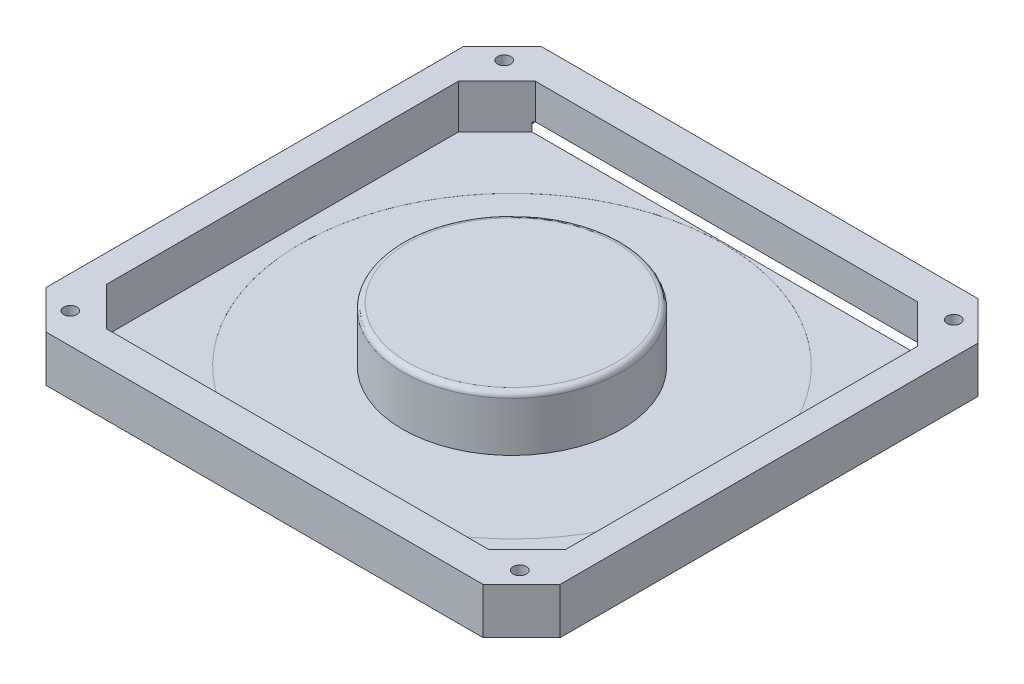
from build123d import *

# Parameters (mm, degrees)
BOSS_EXTRUDE1_DEPTH           = 8.4
CUT_EXTRUDE1_DEPTH            = 66.430287329
CUT_EXTRUDE1_DEPTH_BACK       = 2
CUT_EXTRUDE2_DEPTH            = 8
SKETCH8_R                     = 19.9
BOSS_EXTRUDE2_DEPTH           = 10
FILLET1_R                     = 1
SKETCH9_R                     = 38.5
CUT_EXTRUDE4_DEPTH            = 0.01
M2_CLEARANCE_HOLE1_AT_2_COUNT = 2
M2_CLEARANCE_HOLE1_AT_2_PITCH = 81.742360825
M2_CLEARANCE_HOLE1_AT_3_COUNT = 2
M2_CLEARANCE_HOLE1_AT_3_PITCH = 113.62
M2_CLEARANCE_HOLE1_AT_4_COUNT = 2
M2_CLEARANCE_HOLE1_AT_4_PITCH = 78.915719896


with BuildPart() as part:
    # Sketch4 → Boss-Extrude1 (new body)
    with BuildSketch(Plane(origin=(0, 0, 0), x_dir=(1, 0, 0), z_dir=(0, 1, 0))):
        Polygon((-46.75, 38), (-39.75, 45), (39.75, 45), (46.75, 38), (46.75, -38), (39.75, -45), (-39.75, -45), (-46.75, -38), align=None)
    extrude(amount=BOSS_EXTRUDE1_DEPTH)

    # Sketch5 → Cut-Extrude1 (cut, two sides: drawn at the far end of the back side and taken through both)
    with BuildSketch(Plane.XZ.offset(-CUT_EXTRUDE1_DEPTH_BACK)):
        with BuildLine():
            Line((36.75, -300.538184403), (36.75, -45))
            Line((36.75, -45), (36.75, -39.704788024))
            ThreePointArc((36.75, -39.704788024), (36.457106781, -38.997681243), (35.75, -38.704788024))
            Line((35.75, -38.704788024), (-35.75, -38.704788024))
            ThreePointArc((-35.75, -38.704788024), (-36.457106781, -38.997681243), (-36.75, -39.704788024))
            Line((-36.75, -39.704788024), (-36.75, -45))
            Line((-36.75, -45), (-36.75, -300.538184403))
            Line((-36.75, -300.538184403), (-36.75, -811.614553209))
            Line((-36.75, -811.614553209), (36.75, -811.614553209))
            Line((36.75, -811.614553209), (36.75, -300.538184403))
        make_face()
    extrude(amount=CUT_EXTRUDE1_DEPTH + CUT_EXTRUDE1_DEPTH_BACK, mode=Mode.SUBTRACT)

    # Sketch6 → Cut-Extrude2 (cut)
    with BuildSketch(Plane(origin=(0, 8.4, 0), x_dir=(1, 0, 0), z_dir=(0, 1, 0))):
        Polygon((-41.75, 32), (-34.75, 39), (34.75, 39), (41.75, 32), (41.75, -32), (34.75, -39), (-34.75, -39), (-41.75, -32), align=None)
    extrude(amount=-CUT_EXTRUDE2_DEPTH, mode=Mode.SUBTRACT)

    # Sketch8 → Boss-Extrude2 (add)
    with BuildSketch(Plane(origin=(0, 0.4, 0), x_dir=(1, 0, 0), z_dir=(0, 1, 0))):
        Circle(SKETCH8_R)
    extrude(amount=BOSS_EXTRUDE2_DEPTH)

    # Fillet1
    fillet1_edges = [part.edges().sort_by_distance(p)[0] for p in [
        (-19.9, 10.4, 0),
    ]]
    fillet(fillet1_edges, radius=FILLET1_R)

    # Sketch9 → Cut-Extrude4 (cut)
    with BuildSketch(Plane(origin=(0, 0.4, 0), x_dir=(1, 0, 0), z_dir=(0, 1, 0))):
        Circle(SKETCH9_R)
    extrude(amount=-CUT_EXTRUDE4_DEPTH, mode=Mode.SUBTRACT)


with BuildPart() as cut_extrude4_piece_1:
    # of the separate pieces the step leaves, piece 1, a body of its own (cut_extrude4_pieces)
    add(part.part.solids().sort_by_distance((-41.75, 0.4, 32))[0])

    # Sketch10 → M2 Clearance Hole1 (revolve, cut)
    with BuildSketch(Plane(origin=(40.871180413, 8.4, 39.457859948), x_dir=(0, 0, 1), z_dir=(1, 0, 0))):
        Polygon((0, 0), (0, 38.821032743), (1.2, 38.1), (1.2, 0), align=None)
    m2_clearance_hole1 = revolve(axis=Axis((40.871180413, 14.75, 39.457859948), (0, -1, 0)), mode=Mode.SUBTRACT)

    # M2 Clearance Hole1 at 2: M2 Clearance Hole1 ×2
    with Locations(*[(-i * M2_CLEARANCE_HOLE1_AT_2_PITCH, 0, 0) for i in range(1, M2_CLEARANCE_HOLE1_AT_2_COUNT)]):
        add(m2_clearance_hole1, mode=Mode.SUBTRACT)

    # M2 Clearance Hole1 at 3: M2 Clearance Hole1 ×2
    with Locations(*[Vector(-0.7194363741011156, 0, -0.6945583514869285) * (i * M2_CLEARANCE_HOLE1_AT_3_PITCH) for i in range(1, M2_CLEARANCE_HOLE1_AT_3_COUNT)]):
        add(m2_clearance_hole1, mode=Mode.SUBTRACT)

    # M2 Clearance Hole1 at 4: M2 Clearance Hole1 ×2
    with Locations(*[(0, 0, -i * M2_CLEARANCE_HOLE1_AT_4_PITCH) for i in range(1, M2_CLEARANCE_HOLE1_AT_4_COUNT)]):
        add(m2_clearance_hole1, mode=Mode.SUBTRACT)


with BuildPart() as cut_extrude4_piece_2:
    # of the separate pieces the step leaves, piece 2, a body of its own (cut_extrude4_pieces)
    add(part.part.solids().sort_by_distance((19.9, 9.4, 0))[0])


solid = Compound([cut_extrude4_piece_1.part, cut_extrude4_piece_2.part])
